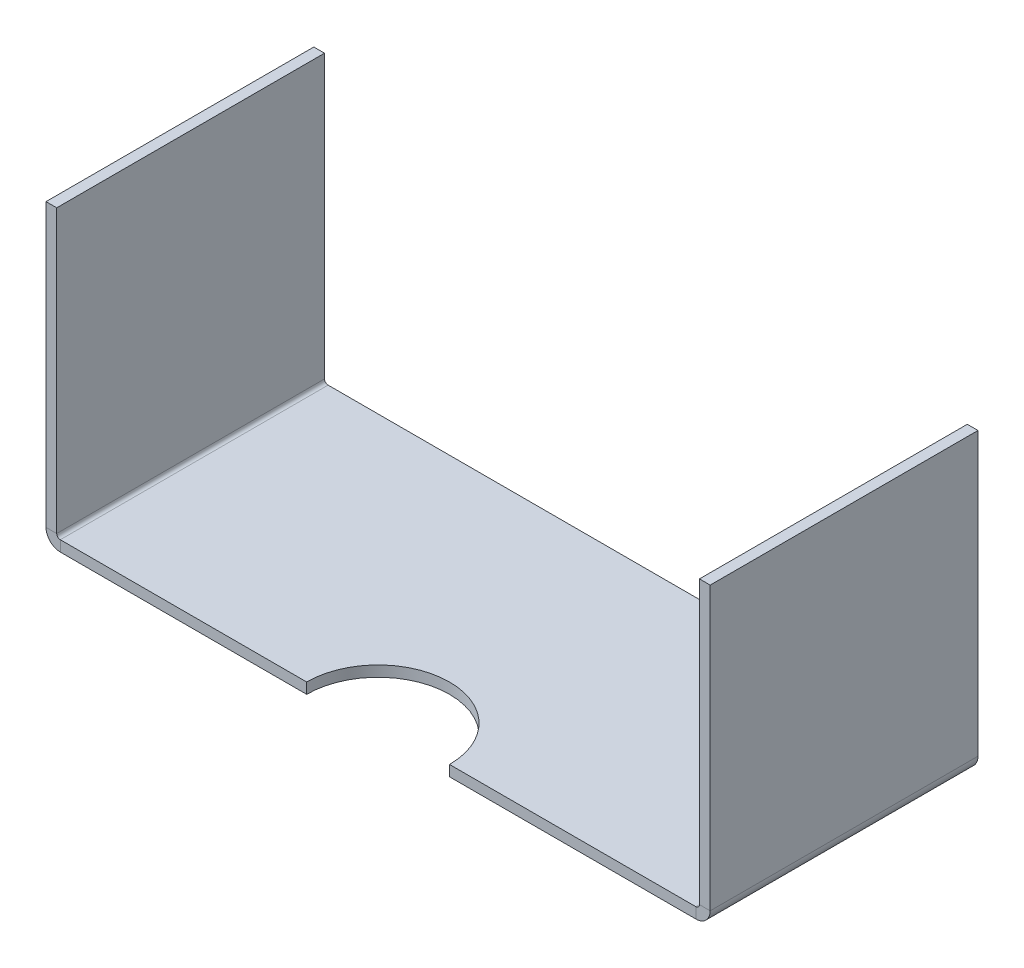
from build123d import *

# Parameters (mm, degrees)
BRIDA_BASE1_DEPTH     = 75
CROQUIS6_R            = 20
CORTAR_EXTRUIR1_DEPTH = 10


# Sheet-metal steps are written as plain solids
with BuildPart() as part:
    # Croquis1 → Brida base1 (new body)
    with BuildSketch(Plane.XY):
        with BuildLine():
            Line((180, 80), (180, 1))
            ThreePointArc((180, 1), (179.707106781, 0.292893219), (179, 0))
            Line((179, 0), (1, 0))
            ThreePointArc((1, 0), (0.292893219, 0.292893219), (0, 1))
            Line((0, 1), (0, 80))
            Line((0, 80), (-3, 80))
            Line((-3, 80), (-3, 1))
            ThreePointArc((-3, 1), (-1.828427125, -1.828427125), (1, -3))
            Line((1, -3), (179, -3))
            ThreePointArc((179, -3), (181.828427125, -1.828427125), (183, 1))
            Line((183, 1), (183, 80))
            Line((183, 80), (180, 80))
        make_face()
    extrude(amount=BRIDA_BASE1_DEPTH)

    # Croquis6 → Cortar-Extruir1 (cut)
    with BuildSketch(Plane(origin=(0, 0, 0), x_dir=(1, 0, 0), z_dir=(0, 1, 0))):
        with Locations((90, -75)):
            Circle(CROQUIS6_R)
    extrude(amount=-CORTAR_EXTRUIR1_DEPTH, mode=Mode.SUBTRACT)


solid = part.part
